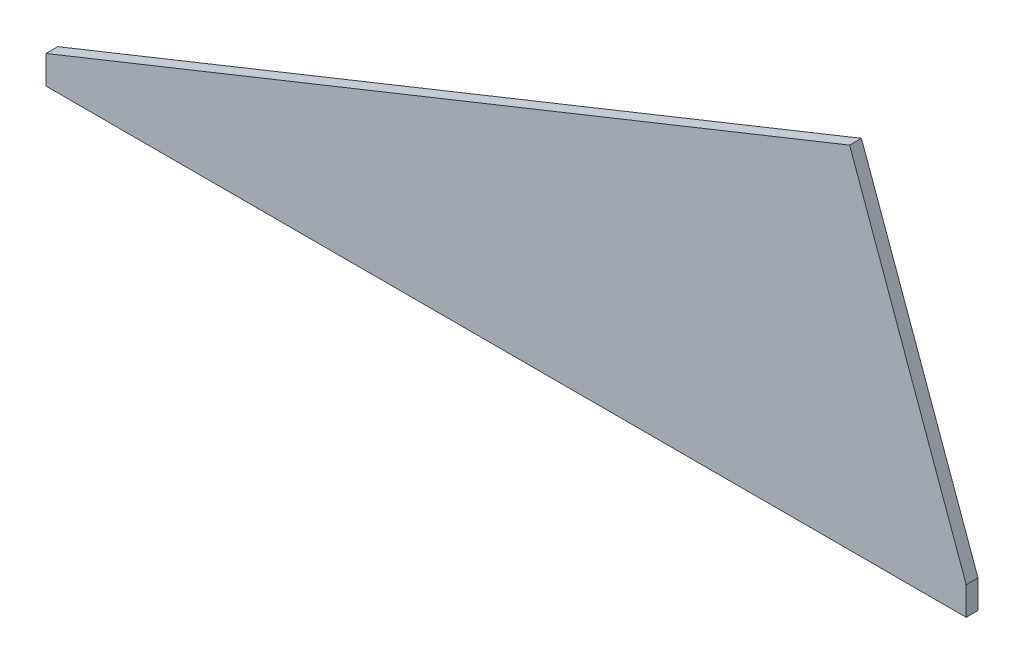
from build123d import *

# Parameters (mm, degrees)
BOSS_EXTRUDE1_DEPTH = 4.76


with BuildPart() as part:
    # Sketch2 → Boss-Extrude1 (new body)
    with BuildSketch(Plane.XY):
        Polygon((0, 2.254954322), (371, 2.254954322), (371, 13.654954322), (324, 143.654954322), (0, 13.654954322), align=None)
    extrude(amount=BOSS_EXTRUDE1_DEPTH)


solid = part.part
